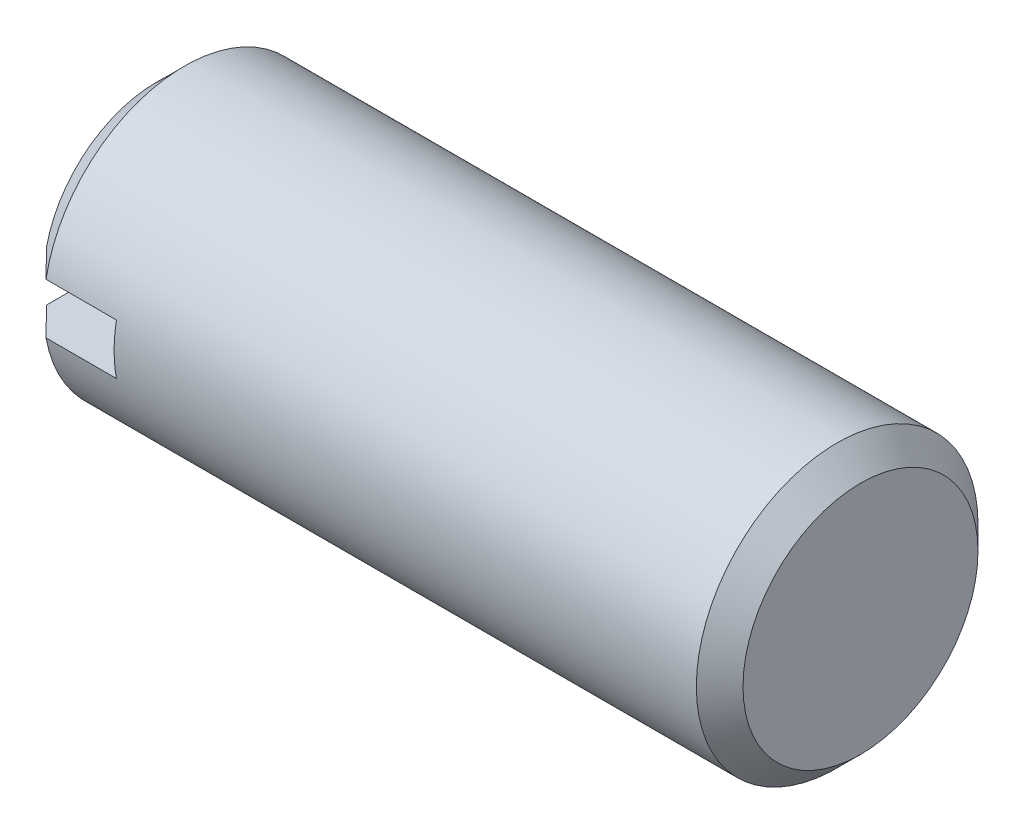
from build123d import *

# Parameters (mm, degrees)
SLOT_DEPTH      = 26.980762114
SLOT_DEPTH_BACK = 26.980762114
SLOTSKE_W       = 3.5
SLOTSKE_H       = 1.8


with BuildPart() as part:
    # BodySke → Base-Revolve (revolve)
    with BuildSketch(Plane.XY):
        Polygon((0, 0), (0, 4), (1, 5), (24.172, 5), (25, 4.172), (25, 0), align=None)
    revolve(axis=Axis((-3.67611336, 0, 0), (1, 0, 0)))

    # SlotSke → Slot (cut, two sides: drawn at the far end of the back side and taken through both)
    with BuildSketch(Plane.XY.offset(-SLOT_DEPTH_BACK)):
        with Locations((1.75, 0)):
            Rectangle(SLOTSKE_W, SLOTSKE_H)
    extrude(amount=SLOT_DEPTH + SLOT_DEPTH_BACK, mode=Mode.SUBTRACT)


solid = part.part
